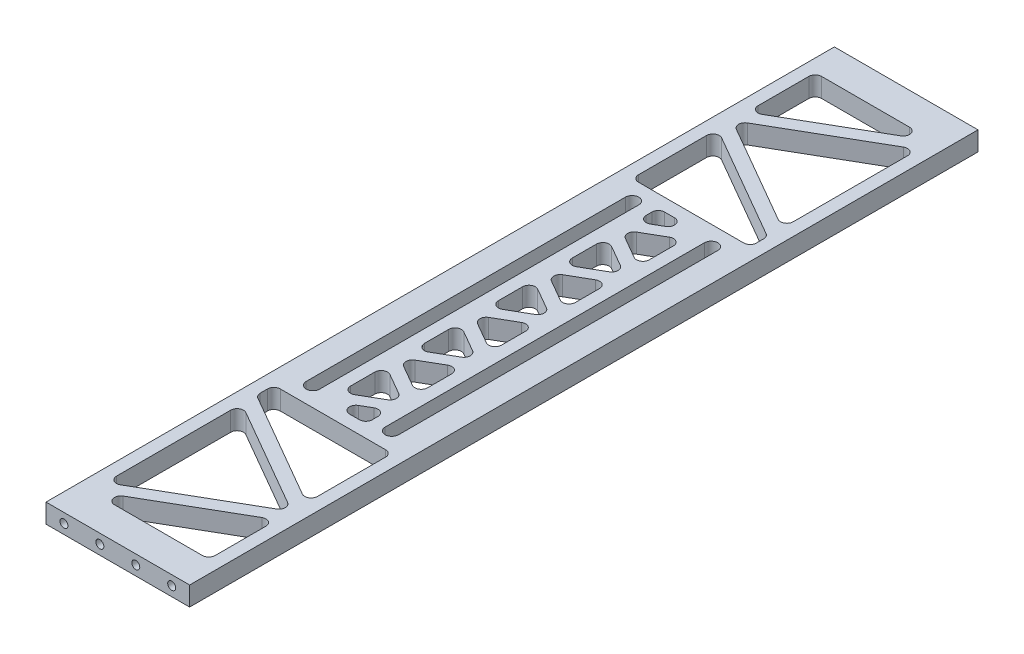
from build123d import *

# Parameters (mm, degrees)
SKETCH_1_W          = 45
SKETCH_1_H          = 247
EXTRUDE_1_DEPTH     = 6
CUT_EXTRUDE_1_DEPTH = 249.095243808
CUT_EXTRUDE_2_DEPTH = 249.095243808
FILLET_1_R          = 2
M3X0_52_D           = 2.5
M3X0_52_DEPTH       = 8.5
M3X0_52_TIP         = 0.751075774
M3X0_51_D           = 2.5
M3X0_51_DEPTH       = 8.5
M3X0_51_TIP         = 0.751075774


with BuildPart() as part:
    # Эскиз1 → Бобышка-Вытянуть1 (new body)
    with BuildSketch(Plane(origin=(0, 0, 0), x_dir=(1, 0, 0), z_dir=(0, 1, 0))):
        with Locations((0, -123.5)):
            Rectangle(SKETCH_1_W, SKETCH_1_H)
    extrude(amount=EXTRUDE_1_DEPTH)

    # Эскиз2 → Вырез-Вытянуть1 (cut, through all)
    with BuildSketch(Plane(origin=(0, 6, 0), x_dir=(1, 0, 0), z_dir=(0, 1, 0))):
        with BuildLine():
            Line((-10.274368671, -73.5), (-10.274368671, -173.5))
            ThreePointArc((-10.274368671, -173.5), (-12.374368671, -175.6), (-14.474368671, -173.5))
            Line((-14.474368671, -173.5), (-14.474368671, -73.5))
            ThreePointArc((-14.474368671, -73.5), (-12.374368671, -71.4), (-10.274368671, -73.5))
        make_face()
        with BuildLine():
            Line((10.274368671, -73.5), (10.274368671, -173.5))
            ThreePointArc((10.274368671, -173.5), (12.374368671, -175.6), (14.474368671, -173.5))
            Line((14.474368671, -173.5), (14.474368671, -73.5))
            ThreePointArc((14.474368671, -73.5), (12.374368671, -71.4), (10.274368671, -73.5))
        make_face()
    extrude(amount=-CUT_EXTRUDE_1_DEPTH, mode=Mode.SUBTRACT)

    # Эскиз14 → Вырез-Вытянуть2 (cut, through all)
    with BuildSketch(Plane(origin=(0, 6, 0), x_dir=(1, 0, 0), z_dir=(0, 1, 0))):
        Polygon((-18.5, -10), (18.5, -10), (-18.5, -31.36195996), align=None)
        Polygon((-18.5, -35.980762114), (18.5, -14.618802154), (18.5, -57.342722074), align=None)
        Polygon((-18.5, -40.599564267), (-18.5, -67.4), (18.5, -67.4), (18.5, -61.961524227), align=None)
        Polygon((6.274368671, -71.4), (-6.274368671, -78.645016882), (-6.274368671, -71.4), align=None)
        Polygon((6.274368671, -75.730127019), (-6.274368671, -82.975143901), (6.274368671, -90.220160783), align=None)
        Polygon((-6.274368671, -87.30527092), (6.274368671, -94.550287802), (-6.274368671, -101.795304684), align=None)
        Polygon((-6.274368671, -106.125431703), (6.274368671, -98.880414821), (6.274368671, -113.370448585), align=None)
        Polygon((-6.274368671, -110.455558722), (6.274368671, -117.700575604), (-6.274368671, -124.945592486), align=None)
        Polygon((-6.274368671, -129.275719505), (6.274368671, -122.030702623), (6.274368671, -136.520736387), align=None)
        Polygon((-6.274368671, -133.605846524), (6.274368671, -140.850863406), (-6.274368671, -148.095880288), align=None)
        Polygon((-6.274368671, -152.426007307), (6.274368671, -145.180990425), (6.274368671, -159.671024189), align=None)
        Polygon((-6.274368671, -156.756134326), (6.274368671, -164.001151208), (-6.274368671, -171.24616809), align=None)
        Polygon((-6.274368671, -175.576295109), (6.274368671, -168.331278227), (6.274368671, -175.576295109), align=None)
        Polygon((-18.5, -179.6), (-18.5, -185.038475773), (18.5, -206.400435733), (18.5, -179.6), align=None)
        Polygon((-18.5, -232.381197846), (-18.5, -189.657277926), (18.5, -211.019237886), align=None)
        Polygon((18.5, -215.63804004), (18.5, -237), (-18.5, -237), align=None)
    extrude(amount=-CUT_EXTRUDE_2_DEPTH, mode=Mode.SUBTRACT)

    # Скругление1
    fillet_1_edges = [part.edges().sort_by_distance(p)[0] for p in [
        (-6.274368671, 3, 175.576295109),
        (6.274368671, 3, 175.576295109),
        (6.274368671, 3, 168.331278227),
        (6.274368671, 3, 145.180990425),
        (-6.274368671, 3, 152.426007307),
        (-6.274368671, 3, 156.756134326),
        (6.274368671, 3, 164.001151208),
        (6.274368671, 3, 159.671024189),
        (-6.274368671, 3, 171.24616809),
        (-6.274368671, 3, 148.095880288),
        (6.274368671, 3, 140.850863406),
        (-6.274368671, 3, 133.605846524),
        (6.274368671, 3, 122.030702623),
        (6.274368671, 3, 136.520736387),
        (-6.274368671, 3, 129.275719505),
        (6.274368671, 3, 117.700575604),
        (-6.274368671, 3, 110.455558722),
        (-6.274368671, 3, 124.945592486),
        (-6.274368671, 3, 101.795304684),
        (6.274368671, 3, 94.550287802),
        (-6.274368671, 3, 106.125431703),
        (6.274368671, 3, 113.370448585),
        (6.274368671, 3, 98.880414821),
        (-6.274368671, 3, 87.30527092),
        (6.274368671, 3, 90.220160783),
        (6.274368671, 3, 75.730127019),
        (-6.274368671, 3, 82.975143901),
        (-6.274368671, 3, 78.645016882),
        (-6.274368671, 3, 71.4),
        (6.274368671, 3, 71.4),
        (-18.5, 3, 40.599564267),
        (-18.5, 3, 67.4),
        (18.5, 3, 67.4),
        (18.5, 3, 61.961524227),
        (18.5, 3, 57.342722074),
        (18.5, 3, 14.618802154),
        (-18.5, 3, 35.980762114),
        (-18.5, 3, 31.36195996),
        (18.5, 3, 10),
        (-18.5, 3, 10),
        (18.5, 3, 237),
        (18.5, 3, 215.63804004),
        (-18.5, 3, 237),
        (-18.5, 3, 232.381197846),
        (18.5, 3, 211.019237886),
        (-18.5, 3, 189.657277926),
        (18.5, 3, 206.400435733),
        (-18.5, 3, 185.038475773),
        (-18.5, 3, 179.6),
        (18.5, 3, 179.6),
    ]]
    fillet(fillet_1_edges, radius=FILLET_1_R)

    # Отверстие обработанное метчиком M3x0.52
    with Locations(Plane(origin=(0, 0, 0), x_dir=(-1, 0, 0), z_dir=(0, 0, -1))):
        with Locations((-16.875, 3), (-5.625, 3), (5.625, 3), (16.875, 3)):
            Hole(M3X0_52_D / 2, depth=M3X0_52_DEPTH)
            with Locations((0, 0, -(M3X0_52_DEPTH + M3X0_52_TIP / 2))):  # 118° drill point
                Cone(0, M3X0_52_D / 2, M3X0_52_TIP, mode=Mode.SUBTRACT)

    # Отверстие обработанное метчиком M3x0.51
    with Locations(Plane.XY.offset(247)):
        with Locations((-16.875, 3), (-5.625, 3), (5.625, 3), (16.875, 3)):
            Hole(M3X0_51_D / 2, depth=M3X0_51_DEPTH)
            with Locations((0, 0, -(M3X0_51_DEPTH + M3X0_51_TIP / 2))):  # 118° drill point
                Cone(0, M3X0_51_D / 2, M3X0_51_TIP, mode=Mode.SUBTRACT)


solid = part.part
